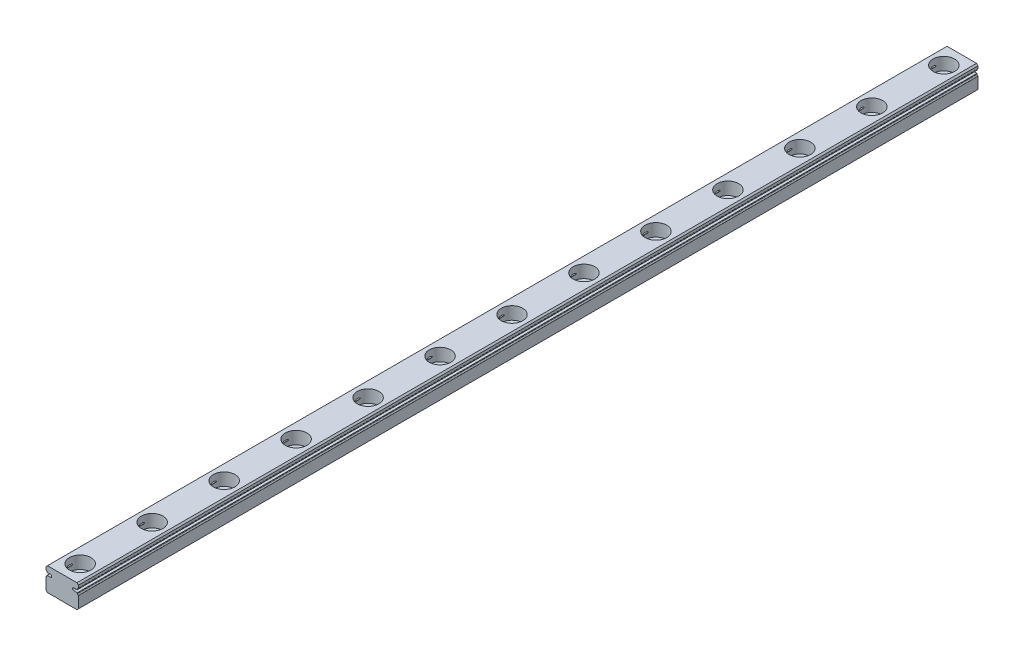
from build123d import *
from OCP.BRepFilletAPI import BRepFilletAPI_MakeChamfer

# Parameters (mm, degrees)
CROQUIS1_W                                           = 9
CROQUIS1_H                                           = 250
SALIENTE_EXTRUIR1_DEPTH                              = 6.5
CORTAR_EXTRUIR1_DEPTH                                = 251.062347284
CORTAR_EXTRUIR2_DEPTH                                = 251.062347284
CORTAR_EXTRUIR3_DEPTH                                = 251.062347284
CORTAR_EXTRUIR4_DEPTH                                = 251.062347284
CORTAR_EXTRUIR5_DEPTH                                = 251.062347284
CORTAR_EXTRUIR6_DEPTH                                = 251.062347284
CORTAR_EXTRUIR7_DEPTH                                = 251.062347284
REFRENTADO_PARA_TORNILLO_CON_CABEZA_HEXA_D           = 3.5
REFRENTADO_PARA_TORNILLO_CON_CABEZA_HEXA_CBORE_D     = 6
REFRENTADO_PARA_TORNILLO_CON_CABEZA_HEXA_CBORE_DEPTH = 3.5
CHAFL_N1_SIZE                                        = 0.4
CHAFL_N2_SIZE                                        = 0.01099309
CHAFL_N2_SIZE2                                       = 0.011992462
CHAFL_N3_SIZE                                        = 0.127904947
CHAFL_N3_SIZE_2                                      = 0.150967803


with BuildPart() as part:
    # Croquis1 → Saliente-Extruir1 (new body)
    with BuildSketch(Plane(origin=(0, 3.305681333, 0), x_dir=(1, 0, 0), z_dir=(0, 1, 0))):
        with Locations((0, -125)):
            Rectangle(CROQUIS1_W, CROQUIS1_H)
    extrude(amount=-SALIENTE_EXTRUIR1_DEPTH)

    # Croquis2 → Cortar-Extruir1 (cut, through all)
    with BuildSketch(Plane(origin=(0, 0, 0), x_dir=(-1, 0, 0), z_dir=(0, 0, -1))):
        with BuildLine():
            Line((1.6, -3.194318667), (2.1, -3.194318667))
            ThreePointArc((2.1, -3.194318667), (1.85, -3.094318667), (1.6, -3.194318667))
        make_face()
    extrude(amount=-CORTAR_EXTRUIR1_DEPTH, mode=Mode.SUBTRACT)

    # Croquis3 → Cortar-Extruir2 (cut, through all)
    with BuildSketch(Plane(origin=(0, 0, 0), x_dir=(-1, 0, 0), z_dir=(0, 0, -1))):
        with BuildLine():
            Line((-4.5, 1.645681333), (-4.5, 0.945681333))
            Line((-4.5, 0.945681333), (-3.25, 0.945681333))
            ThreePointArc((-3.25, 0.945681333), (-2.9, 1.295681333), (-3.25, 1.645681333))
            Line((-3.25, 1.645681333), (-4.5, 1.645681333))
        make_face()
    extrude(amount=-CORTAR_EXTRUIR2_DEPTH, mode=Mode.SUBTRACT)

    # Croquis4 → Cortar-Extruir3 (cut, through all)
    with BuildSketch(Plane(origin=(0, 0, 0), x_dir=(-1, 0, 0), z_dir=(0, 0, -1))):
        with BuildLine():
            Line((-4.335296409, 0.945681333), (-4.5, 0.945681333))
            Line((-4.5, 0.945681333), (-4.5, 0.416920311))
            ThreePointArc((-4.5, 0.416920311), (-4.287857678, 0.640872415), (-4.335296409, 0.945681333))
        make_face()
    extrude(amount=-CORTAR_EXTRUIR3_DEPTH, mode=Mode.SUBTRACT)

    # Croquis5 → Cortar-Extruir4 (cut, through all)
    with BuildSketch(Plane(origin=(0, 0, 0), x_dir=(-1, 0, 0), z_dir=(0, 0, -1))):
        with BuildLine():
            Line((-4.5, 2.174442354), (-4.5, 1.645681333))
            Line((-4.5, 1.645681333), (-4.335296409, 1.645681333))
            ThreePointArc((-4.335296409, 1.645681333), (-4.287857678, 1.950490251), (-4.5, 2.174442354))
        make_face()
    extrude(amount=-CORTAR_EXTRUIR4_DEPTH, mode=Mode.SUBTRACT)

    # Croquis6 → Cortar-Extruir5 (cut, through all)
    with BuildSketch(Plane(origin=(0, 0, 0), x_dir=(-1, 0, 0), z_dir=(0, 0, -1))):
        with BuildLine():
            Line((4.5, 0.945681333), (4.5, 1.645681333))
            Line((4.5, 1.645681333), (3.25, 1.645681333))
            ThreePointArc((3.25, 1.645681333), (2.9, 1.295681333), (3.25, 0.945681333))
            Line((3.25, 0.945681333), (4.5, 0.945681333))
        make_face()
    extrude(amount=-CORTAR_EXTRUIR5_DEPTH, mode=Mode.SUBTRACT)

    # Croquis7 → Cortar-Extruir6 (cut, through all)
    with BuildSketch(Plane(origin=(0, 0, 0), x_dir=(-1, 0, 0), z_dir=(0, 0, -1))):
        with BuildLine():
            Line((4.335296409, 1.645681333), (4.5, 1.645681333))
            Line((4.5, 1.645681333), (4.5, 2.174442354))
            ThreePointArc((4.5, 2.174442354), (4.287857678, 1.950490251), (4.335296409, 1.645681333))
        make_face()
    extrude(amount=-CORTAR_EXTRUIR6_DEPTH, mode=Mode.SUBTRACT)

    # Croquis8 → Cortar-Extruir7 (cut, through all)
    with BuildSketch(Plane(origin=(0, 0, 0), x_dir=(-1, 0, 0), z_dir=(0, 0, -1))):
        with BuildLine():
            Line((4.5, 0.416920311), (4.5, 0.945681333))
            Line((4.5, 0.945681333), (4.335296409, 0.945681333))
            ThreePointArc((4.335296409, 0.945681333), (4.287857678, 0.640872415), (4.5, 0.416920311))
        make_face()
    extrude(amount=-CORTAR_EXTRUIR7_DEPTH, mode=Mode.SUBTRACT)

    # Refrentado para tornillo con cabeza hexagonal de M31 (through all)
    with Locations(Plane(origin=(0, 3.305681333, 0), x_dir=(1, 0, 0), z_dir=(0, 1, 0))):
        with Locations((0, -245), (0, -225), (0, -205), (0, -185), (0, -165), (0, -145), (0, -125), (0, -105), (0, -85), (0, -65), (0, -45), (0, -25), (0, -5)):
            CounterBoreHole(REFRENTADO_PARA_TORNILLO_CON_CABEZA_HEXA_D / 2, REFRENTADO_PARA_TORNILLO_CON_CABEZA_HEXA_CBORE_D / 2, REFRENTADO_PARA_TORNILLO_CON_CABEZA_HEXA_CBORE_DEPTH)

    # Chaflán1
    chafl_n1_edges = [part.edges().sort_by_distance(p)[0] for p in [
        (-4.5, -3.194318667, 125),
        (4.5, -3.194318667, 125),
        (-4.5, 3.305681333, 125),
        (4.5, 3.305681333, 125),
    ]]
    chamfer(chafl_n1_edges, length=CHAFL_N1_SIZE)

    # Chaflán2: one chamfer whose edges measure the first distance from different faces: ONE call of the kernel's chamfer builder (chamfer() names one face for all edges)
    chafl_n2_edges_1 = [part.edges().sort_by_distance(p)[0] for p in [
        (4.5, 0.416920311, 125),
    ]]
    chafl_n2_side_1 = [part.faces().sort_by_distance(p)[0] for p in [
        (4.287857678, 0.640872415, 125),
    ]]
    chafl_n2_edges_2 = [part.edges().sort_by_distance(p)[0] for p in [
        (4.5, 2.174442354, 125),
    ]]
    chafl_n2_side_2 = [part.faces().sort_by_distance(p)[0] for p in [
        (4.5, 2.540061844, 125),
    ]]
    chafl_n2_edges_3 = [part.edges().sort_by_distance(p)[0] for p in [
        (-4.5, 2.174442354, 125),
    ]]
    chafl_n2_side_3 = [part.faces().sort_by_distance(p)[0] for p in [
        (-4.5, 2.540061844, 125),
    ]]
    chafl_n2_edges_4 = [part.edges().sort_by_distance(p)[0] for p in [
        (-4.5, 0.416920311, 125),
    ]]
    chafl_n2_side_4 = [part.faces().sort_by_distance(p)[0] for p in [
        (-4.287857678, 0.640872415, 125),
    ]]
    chafl_n2 = BRepFilletAPI_MakeChamfer(part.part.solid().wrapped)
    for e in chafl_n2_edges_1:
        chafl_n2.Add(CHAFL_N2_SIZE, CHAFL_N2_SIZE2, e.wrapped, chafl_n2_side_1[0].wrapped)  # the first distance lies on this face
    for e in chafl_n2_edges_2:
        chafl_n2.Add(CHAFL_N2_SIZE, CHAFL_N2_SIZE2, e.wrapped, chafl_n2_side_2[0].wrapped)  # the first distance lies on this face
    for e in chafl_n2_edges_3:
        chafl_n2.Add(CHAFL_N2_SIZE, CHAFL_N2_SIZE2, e.wrapped, chafl_n2_side_3[0].wrapped)  # the first distance lies on this face
    for e in chafl_n2_edges_4:
        chafl_n2.Add(CHAFL_N2_SIZE, CHAFL_N2_SIZE2, e.wrapped, chafl_n2_side_4[0].wrapped)  # the first distance lies on this face
    add(Compound.cast(chafl_n2.Shape()), mode=Mode.REPLACE)

    # Chaflán3
    # the kernel refuses this chamfer: 0.150967803, 0.127904947 mm, written as the material it takes off along each edge
    with BuildSketch(Plane(origin=(4.335296409, 0.945681333, -0.52140873), x_dir=(-1, 0, 0), z_dir=(0, 0, 1))) as chafl_n3_piece_1:
        with BuildLine():
            Line((CHAFL_N3_SIZE * 0.999999997415, 0), (0.063202886, 0.193627514))
            ThreePointArc((0.063202886, 0.193627514), (0.046780091, 0.094540285), (0, 0))
            Line((0, 0), (CHAFL_N3_SIZE * 0.999999997415, 0))
        make_face()
    extrude(amount=251.04281746, mode=Mode.SUBTRACT)
    with BuildSketch(Plane(origin=(4.335296409, 1.645681333, -0.386595906), x_dir=(-0.39790739752013976, 0.9174255844474523, 0), z_dir=(0, 0, 1))) as chafl_n3_piece_2:
        with BuildLine():
            Line((0.140111683, 0), (CHAFL_N3_SIZE_2 * 0.397907396617, CHAFL_N3_SIZE_2 * 0.917425582366))
            Line((CHAFL_N3_SIZE_2 * 0.397907396617, CHAFL_N3_SIZE_2 * 0.917425582366), (0, 0))
            ThreePointArc((0, 0), (0.071609636, 0.00707939), (0.140111683, 0))
        make_face()
    extrude(amount=250.773191813, mode=Mode.SUBTRACT)
    with BuildSketch(Plane(origin=(-4.335296409, 1.645681333, -0.52140873), x_dir=(0.3103022888966752, 0.950637938179139, 0), z_dir=(0, 0, 1))) as chafl_n3_piece_3:
        with BuildLine():
            Line((0.203681661, 0), (CHAFL_N3_SIZE * 0.310302288095, -CHAFL_N3_SIZE * 0.950637935722))
            Line((CHAFL_N3_SIZE * 0.310302288095, -CHAFL_N3_SIZE * 0.950637935722), (0, 0))
            ThreePointArc((0, 0), (0.104389551, -0.015134863), (0.203681661, 0))
        make_face()
    extrude(amount=251.04281746, mode=Mode.SUBTRACT)
    with BuildSketch(Plane(origin=(-4.335296409, 0.945681333, -0.386595906), x_dir=(1, 0, 0), z_dir=(0, 0, 1))) as chafl_n3_piece_4:
        with BuildLine():
            Line((CHAFL_N3_SIZE_2 * 0.999999997731, 0), (0.055751475, -0.128542042))
            ThreePointArc((0.055751475, -0.128542042), (0.034988818, -0.06287957), (0, 0))
            Line((0, 0), (CHAFL_N3_SIZE_2 * 0.999999997731, 0))
        make_face()
    extrude(amount=250.773191813, mode=Mode.SUBTRACT)


solid = part.part
